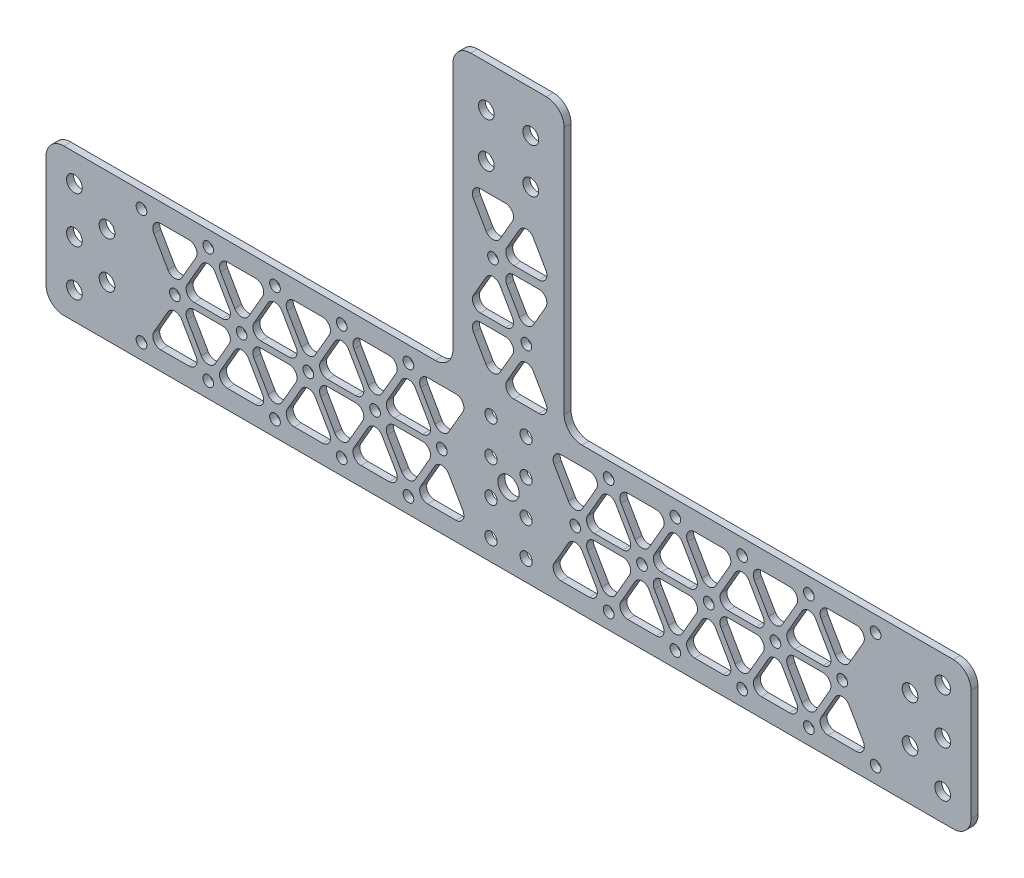
from build123d import *

# Parameters (mm, degrees)
SKETCH1_W               = 264.0778243
SKETCH1_H               = 41.91
BOSS_EXTRUDE1_DEPTH     = 1.9812
SKETCH2_R               = 2.2479
CUT_EXTRUDE1_DEPTH      = 2.54
SKETCH3_R               = 3.05
SKETCH3_R_2             = 1.75
CUT_EXTRUDE2_DEPTH      = 2.54
SKETCH4_W               = 31.75
SKETCH4_H               = 81.056319486
BOSS_EXTRUDE2_DEPTH     = 1.9812
CUT_EXTRUDE3_REACH      = 168.867
SKETCH5_R               = 2.2479
FLAT_ISOGRID1_OUTLINE_R = 1.524
FLAT_ISOGRID1_DEPTH     = 1.9812
FLAT_ISOGRID2_OUTLINE_R = 1.524
FLAT_ISOGRID2_DEPTH     = 1.9812
SKETCH9_R               = 1.524
BOSS_EXTRUDE3_DEPTH     = 1.9812
FILLET1_R               = 5.08


# Read off the part's stored shape, not the designer's step: Flat-Isogrid1, Flat-Isogrid2
with BuildPart() as part:
    # Sketch1 → Boss-Extrude1 (new body)
    with BuildSketch(Plane.XY):
        Rectangle(SKETCH1_W, SKETCH1_H)
    extrude(amount=BOSS_EXTRUDE1_DEPTH)

    # Sketch2 → Cut-Extrude1 (cut)
    with BuildSketch(Plane(origin=(0, 0, 0), x_dir=(-1, 0, 0), z_dir=(0, 0, -1))):
        with Locations((123.929430386, 13.127417544)):
            Circle(SKETCH2_R)
        with Locations((123.929430386, 0)):
            Circle(SKETCH2_R)
        with Locations((123.929430386, -13.127417544)):
            Circle(SKETCH2_R)
        with Locations((114.624809998, 6.563708772)):
            Circle(SKETCH2_R)
        with Locations((114.624809998, -6.563708772)):
            Circle(SKETCH2_R)
    cut_extrude1 = extrude(amount=-CUT_EXTRUDE1_DEPTH, mode=Mode.SUBTRACT)

    # Sketch3 → Cut-Extrude2 (cut)
    with BuildSketch(Plane(origin=(0, 0, 0), x_dir=(-1, 0, 0), z_dir=(0, 0, -1))):
        Circle(SKETCH3_R)
        with Locations((-5.020458146, 15.061374439)):
            Circle(SKETCH3_R_2)
        with Locations((5.020458146, -15.061374439)):
            Circle(SKETCH3_R_2)
        with Locations((-5.020458146, -5.020458146)):
            Circle(SKETCH3_R_2)
        with Locations((5.020458146, 5.020458146)):
            Circle(SKETCH3_R_2)
        with Locations((5.020458146, -5.020458146)):
            Circle(SKETCH3_R_2)
        with Locations((-5.020458146, 5.020458146)):
            Circle(SKETCH3_R_2)
        with Locations((-5.020458146, -15.061374439)):
            Circle(SKETCH3_R_2)
        with Locations((5.020458146, 15.061374439)):
            Circle(SKETCH3_R_2)
    extrude(amount=-CUT_EXTRUDE2_DEPTH, mode=Mode.SUBTRACT)

    # Sketch4 → Boss-Extrude2 (add)
    with BuildSketch(Plane(origin=(0, 0, 0), x_dir=(-1, 0, 0), z_dir=(0, 0, -1))):
        with Locations((0, 61.483159743)):
            Rectangle(SKETCH4_W, SKETCH4_H)
    extrude(amount=-BOSS_EXTRUDE2_DEPTH)

    # Sketch5 → Cut-Extrude3 (cut, up to next)
    with BuildSketch(Plane(origin=(0, 0, 0), x_dir=(-1, 0, 0), z_dir=(0, 0, -1)), mode=Mode.PRIVATE) as cut_extrude3_sk1:
        with Locations((-6.35, 90.168884441)):
            Circle(SKETCH5_R)
    cut_extrude3_tool1 = extrude(cut_extrude3_sk1.sketch, amount=-CUT_EXTRUDE3_REACH, mode=Mode.PRIVATE) & part.part
    # Sketch5 → Cut-Extrude3 (cut, up to next)
    with BuildSketch(Plane(origin=(0, 0, 0), x_dir=(-1, 0, 0), z_dir=(0, 0, -1)), mode=Mode.PRIVATE) as cut_extrude3_sk2:
        with Locations((6.35, 90.168884441)):
            Circle(SKETCH5_R)
    cut_extrude3_tool2 = extrude(cut_extrude3_sk2.sketch, amount=-CUT_EXTRUDE3_REACH, mode=Mode.PRIVATE) & part.part
    # Sketch5 → Cut-Extrude3 (cut, up to next)
    with BuildSketch(Plane(origin=(0, 0, 0), x_dir=(-1, 0, 0), z_dir=(0, 0, -1)), mode=Mode.PRIVATE) as cut_extrude3_sk3:
        with Locations((-6.35, 77.468884441)):
            Circle(SKETCH5_R)
    cut_extrude3_tool3 = extrude(cut_extrude3_sk3.sketch, amount=-CUT_EXTRUDE3_REACH, mode=Mode.PRIVATE) & part.part
    # Sketch5 → Cut-Extrude3 (cut, up to next)
    with BuildSketch(Plane(origin=(0, 0, 0), x_dir=(-1, 0, 0), z_dir=(0, 0, -1)), mode=Mode.PRIVATE) as cut_extrude3_sk4:
        with Locations((6.35, 77.468884441)):
            Circle(SKETCH5_R)
    cut_extrude3_tool4 = extrude(cut_extrude3_sk4.sketch, amount=-CUT_EXTRUDE3_REACH, mode=Mode.PRIVATE) & part.part
    add(cut_extrude3_tool1.solids().sort_by_distance((6.35, 90.168884, 0))[0], mode=Mode.SUBTRACT)
    add(cut_extrude3_tool2.solids().sort_by_distance((-6.35, 90.168884, 0))[0], mode=Mode.SUBTRACT)
    add(cut_extrude3_tool3.solids().sort_by_distance((6.35, 77.468884, 0))[0], mode=Mode.SUBTRACT)
    add(cut_extrude3_tool4.solids().sort_by_distance((-6.35, 77.468884, 0))[0], mode=Mode.SUBTRACT)

    # Mirror1: Cut-Extrude1 across plane
    add(cut_extrude1.mirror(Plane(origin=(0, 0, 0), x_dir=(0, 0, 1), z_dir=(1, 0, 0))), mode=Mode.SUBTRACT)

    # Flat-Isogrid1 outline → Flat-Isogrid1 (cut)
    with BuildSketch(Plane.XY):
        with Locations((-19.05, 0)):
            Circle(FLAT_ISOGRID1_OUTLINE_R)
        with Locations((19.05, 0)):
            Circle(FLAT_ISOGRID1_OUTLINE_R)
        with Locations((-38.1, 0)):
            Circle(FLAT_ISOGRID1_OUTLINE_R)
        with Locations((-28.575, 16.497783942)):
            Circle(FLAT_ISOGRID1_OUTLINE_R)
        with Locations((-28.575, -16.497783942)):
            Circle(FLAT_ISOGRID1_OUTLINE_R)
        with Locations((28.575, 16.497783942)):
            Circle(FLAT_ISOGRID1_OUTLINE_R)
        with Locations((38.1, 0)):
            Circle(FLAT_ISOGRID1_OUTLINE_R)
        with Locations((28.575, -16.497783942)):
            Circle(FLAT_ISOGRID1_OUTLINE_R)
        with Locations((-57.15, 0)):
            Circle(FLAT_ISOGRID1_OUTLINE_R)
        with Locations((-47.625, 16.497783942)):
            Circle(FLAT_ISOGRID1_OUTLINE_R)
        with Locations((-47.625, -16.497783942)):
            Circle(FLAT_ISOGRID1_OUTLINE_R)
        with Locations((47.625, 16.497783942)):
            Circle(FLAT_ISOGRID1_OUTLINE_R)
        with Locations((57.15, 0)):
            Circle(FLAT_ISOGRID1_OUTLINE_R)
        with Locations((47.625, -16.497783942)):
            Circle(FLAT_ISOGRID1_OUTLINE_R)
        with Locations((-76.2, 0)):
            Circle(FLAT_ISOGRID1_OUTLINE_R)
        with Locations((-66.675, 16.497783942)):
            Circle(FLAT_ISOGRID1_OUTLINE_R)
        with Locations((-66.675, -16.497783942)):
            Circle(FLAT_ISOGRID1_OUTLINE_R)
        with Locations((66.675, 16.497783942)):
            Circle(FLAT_ISOGRID1_OUTLINE_R)
        with Locations((76.2, 0)):
            Circle(FLAT_ISOGRID1_OUTLINE_R)
        with Locations((66.675, -16.497783942)):
            Circle(FLAT_ISOGRID1_OUTLINE_R)
        with Locations((-95.25, 0)):
            Circle(FLAT_ISOGRID1_OUTLINE_R)
        with Locations((-85.725, 16.497783942)):
            Circle(FLAT_ISOGRID1_OUTLINE_R)
        with Locations((-85.725, -16.497783942)):
            Circle(FLAT_ISOGRID1_OUTLINE_R)
        with Locations((85.725, 16.497783942)):
            Circle(FLAT_ISOGRID1_OUTLINE_R)
        with Locations((95.25, 0)):
            Circle(FLAT_ISOGRID1_OUTLINE_R)
        with Locations((85.725, -16.497783942)):
            Circle(FLAT_ISOGRID1_OUTLINE_R)
        with Locations((-104.775, 16.497783942)):
            Circle(FLAT_ISOGRID1_OUTLINE_R)
        with Locations((-104.775, -16.497783942)):
            Circle(FLAT_ISOGRID1_OUTLINE_R)
        with Locations((104.775, 16.497783942)):
            Circle(FLAT_ISOGRID1_OUTLINE_R)
        with Locations((104.775, -16.497783942)):
            Circle(FLAT_ISOGRID1_OUTLINE_R)
        with BuildLine():
            ThreePointArc((-34.580472759, 4.318), (-34.580472759, 2.032), (-32.600738686, 0.889))
            Line((-32.600738686, 0.889), (-24.549261314, 0.889))
            ThreePointArc((-24.549261314, 0.889), (-22.569527241, 2.032), (-22.569527241, 4.318))
            Line((-22.569527241, 4.318), (-26.595265927, 11.290783942))
            ThreePointArc((-26.595265927, 11.290783942), (-28.575, 12.433783942), (-30.554734073, 11.290783942))
            Line((-30.554734073, 11.290783942), (-34.580472759, 4.318))
        make_face()
        with BuildLine():
            ThreePointArc((22.569527241, 4.318), (22.569527241, 2.032), (24.549261314, 0.889))
            Line((24.549261314, 0.889), (32.600738686, 0.889))
            ThreePointArc((32.600738686, 0.889), (34.580472759, 2.032), (34.580472759, 4.318))
            Line((34.580472759, 4.318), (30.554734073, 11.290783942))
            ThreePointArc((30.554734073, 11.290783942), (28.575, 12.433783942), (26.595265927, 11.290783942))
            Line((26.595265927, 11.290783942), (22.569527241, 4.318))
        make_face()
        with BuildLine():
            ThreePointArc((-53.630472759, 4.318), (-53.630472759, 2.032), (-51.650738686, 0.889))
            Line((-51.650738686, 0.889), (-43.599261314, 0.889))
            ThreePointArc((-43.599261314, 0.889), (-41.619527241, 2.032), (-41.619527241, 4.318))
            Line((-41.619527241, 4.318), (-45.645265927, 11.290783942))
            ThreePointArc((-45.645265927, 11.290783942), (-47.625, 12.433783942), (-49.604734073, 11.290783942))
            Line((-49.604734073, 11.290783942), (-53.630472759, 4.318))
        make_face()
        with BuildLine():
            ThreePointArc((41.619527241, 4.318), (41.619527241, 2.032), (43.599261314, 0.889))
            Line((43.599261314, 0.889), (51.650738686, 0.889))
            ThreePointArc((51.650738686, 0.889), (53.630472759, 2.032), (53.630472759, 4.318))
            Line((53.630472759, 4.318), (49.604734073, 11.290783942))
            ThreePointArc((49.604734073, 11.290783942), (47.625, 12.433783942), (45.645265927, 11.290783942))
            Line((45.645265927, 11.290783942), (41.619527241, 4.318))
        make_face()
        with BuildLine():
            ThreePointArc((-72.680472759, 4.318), (-72.680472759, 2.032), (-70.700738686, 0.889))
            Line((-70.700738686, 0.889), (-62.649261314, 0.889))
            ThreePointArc((-62.649261314, 0.889), (-60.669527241, 2.032), (-60.669527241, 4.318))
            Line((-60.669527241, 4.318), (-64.695265927, 11.290783942))
            ThreePointArc((-64.695265927, 11.290783942), (-66.675, 12.433783942), (-68.654734073, 11.290783942))
            Line((-68.654734073, 11.290783942), (-72.680472759, 4.318))
        make_face()
        with BuildLine():
            ThreePointArc((60.669527241, 4.318), (60.669527241, 2.032), (62.649261314, 0.889))
            Line((62.649261314, 0.889), (70.700738686, 0.889))
            ThreePointArc((70.700738686, 0.889), (72.680472759, 2.032), (72.680472759, 4.318))
            Line((72.680472759, 4.318), (68.654734073, 11.290783942))
            ThreePointArc((68.654734073, 11.290783942), (66.675, 12.433783942), (64.695265927, 11.290783942))
            Line((64.695265927, 11.290783942), (60.669527241, 4.318))
        make_face()
        with BuildLine():
            ThreePointArc((-91.730472759, 4.318), (-91.730472759, 2.032), (-89.750738686, 0.889))
            Line((-89.750738686, 0.889), (-81.699261314, 0.889))
            ThreePointArc((-81.699261314, 0.889), (-79.719527241, 2.032), (-79.719527241, 4.318))
            Line((-79.719527241, 4.318), (-83.745265927, 11.290783942))
            ThreePointArc((-83.745265927, 11.290783942), (-85.725, 12.433783942), (-87.704734073, 11.290783942))
            Line((-87.704734073, 11.290783942), (-91.730472759, 4.318))
        make_face()
        with BuildLine():
            ThreePointArc((79.719527241, 4.318), (79.719527241, 2.032), (81.699261314, 0.889))
            Line((81.699261314, 0.889), (89.750738686, 0.889))
            ThreePointArc((89.750738686, 0.889), (91.730472759, 2.032), (91.730472759, 4.318))
            Line((91.730472759, 4.318), (87.704734073, 11.290783942))
            ThreePointArc((87.704734073, 11.290783942), (85.725, 12.433783942), (83.745265927, 11.290783942))
            Line((83.745265927, 11.290783942), (79.719527241, 4.318))
        make_face()
        with BuildLine():
            ThreePointArc((-15.024261314, -15.608783942), (-13.044527241, -14.465783942), (-13.044527241, -12.179783942))
            Line((-13.044527241, -12.179783942), (-17.070265927, -5.207))
            ThreePointArc((-17.070265927, -5.207), (-19.05, -4.064), (-21.029734073, -5.207))
            Line((-21.029734073, -5.207), (-25.055472759, -12.179783942))
            ThreePointArc((-25.055472759, -12.179783942), (-25.055472759, -14.465783942), (-23.075738686, -15.608783942))
            Line((-23.075738686, -15.608783942), (-15.024261314, -15.608783942))
        make_face()
        with BuildLine():
            ThreePointArc((-36.120265927, -5.207), (-38.1, -4.064), (-40.079734073, -5.207))
            Line((-40.079734073, -5.207), (-44.105472759, -12.179783942))
            ThreePointArc((-44.105472759, -12.179783942), (-44.105472759, -14.465783942), (-42.125738686, -15.608783942))
            Line((-42.125738686, -15.608783942), (-34.074261314, -15.608783942))
            ThreePointArc((-34.074261314, -15.608783942), (-32.094527241, -14.465783942), (-32.094527241, -12.179783942))
            Line((-32.094527241, -12.179783942), (-36.120265927, -5.207))
        make_face()
        with BuildLine():
            ThreePointArc((-13.044527241, 12.179783942), (-13.044527241, 14.465783942), (-15.024261314, 15.608783942))
            Line((-15.024261314, 15.608783942), (-23.075738686, 15.608783942))
            ThreePointArc((-23.075738686, 15.608783942), (-25.055472759, 14.465783942), (-25.055472759, 12.179783942))
            Line((-25.055472759, 12.179783942), (-21.029734073, 5.207))
            ThreePointArc((-21.029734073, 5.207), (-19.05, 4.064), (-17.070265927, 5.207))
            Line((-17.070265927, 5.207), (-13.044527241, 12.179783942))
        make_face()
        with BuildLine():
            ThreePointArc((25.055472759, 12.179783942), (25.055472759, 14.465783942), (23.075738686, 15.608783942))
            Line((23.075738686, 15.608783942), (15.024261314, 15.608783942))
            ThreePointArc((15.024261314, 15.608783942), (13.044527241, 14.465783942), (13.044527241, 12.179783942))
            Line((13.044527241, 12.179783942), (17.070265927, 5.207))
            ThreePointArc((17.070265927, 5.207), (19.05, 4.064), (21.029734073, 5.207))
            Line((21.029734073, 5.207), (25.055472759, 12.179783942))
        make_face()
        with BuildLine():
            ThreePointArc((-32.094527241, 12.179783942), (-32.094527241, 14.465783942), (-34.074261314, 15.608783942))
            Line((-34.074261314, 15.608783942), (-42.125738686, 15.608783942))
            ThreePointArc((-42.125738686, 15.608783942), (-44.105472759, 14.465783942), (-44.105472759, 12.179783942))
            Line((-44.105472759, 12.179783942), (-40.079734073, 5.207))
            ThreePointArc((-40.079734073, 5.207), (-38.1, 4.064), (-36.120265927, 5.207))
            Line((-36.120265927, 5.207), (-32.094527241, 12.179783942))
        make_face()
        with BuildLine():
            ThreePointArc((44.105472759, 12.179783942), (44.105472759, 14.465783942), (42.125738686, 15.608783942))
            Line((42.125738686, 15.608783942), (34.074261314, 15.608783942))
            ThreePointArc((34.074261314, 15.608783942), (32.094527241, 14.465783942), (32.094527241, 12.179783942))
            Line((32.094527241, 12.179783942), (36.120265927, 5.207))
            ThreePointArc((36.120265927, 5.207), (38.1, 4.064), (40.079734073, 5.207))
            Line((40.079734073, 5.207), (44.105472759, 12.179783942))
        make_face()
        with BuildLine():
            ThreePointArc((-51.144527241, 12.179783942), (-51.144527241, 14.465783942), (-53.124261314, 15.608783942))
            Line((-53.124261314, 15.608783942), (-61.175738686, 15.608783942))
            ThreePointArc((-61.175738686, 15.608783942), (-63.155472759, 14.465783942), (-63.155472759, 12.179783942))
            Line((-63.155472759, 12.179783942), (-59.129734073, 5.207))
            ThreePointArc((-59.129734073, 5.207), (-57.15, 4.064), (-55.170265927, 5.207))
            Line((-55.170265927, 5.207), (-51.144527241, 12.179783942))
        make_face()
        with BuildLine():
            ThreePointArc((63.155472759, 12.179783942), (63.155472759, 14.465783942), (61.175738686, 15.608783942))
            Line((61.175738686, 15.608783942), (53.124261314, 15.608783942))
            ThreePointArc((53.124261314, 15.608783942), (51.144527241, 14.465783942), (51.144527241, 12.179783942))
            Line((51.144527241, 12.179783942), (55.170265927, 5.207))
            ThreePointArc((55.170265927, 5.207), (57.15, 4.064), (59.129734073, 5.207))
            Line((59.129734073, 5.207), (63.155472759, 12.179783942))
        make_face()
        with BuildLine():
            ThreePointArc((-70.194527241, 12.179783942), (-70.194527241, 14.465783942), (-72.174261314, 15.608783942))
            Line((-72.174261314, 15.608783942), (-80.225738686, 15.608783942))
            ThreePointArc((-80.225738686, 15.608783942), (-82.205472759, 14.465783942), (-82.205472759, 12.179783942))
            Line((-82.205472759, 12.179783942), (-78.179734073, 5.207))
            ThreePointArc((-78.179734073, 5.207), (-76.2, 4.064), (-74.220265927, 5.207))
            Line((-74.220265927, 5.207), (-70.194527241, 12.179783942))
        make_face()
        with BuildLine():
            ThreePointArc((82.205472759, 12.179783942), (82.205472759, 14.465783942), (80.225738686, 15.608783942))
            Line((80.225738686, 15.608783942), (72.174261314, 15.608783942))
            ThreePointArc((72.174261314, 15.608783942), (70.194527241, 14.465783942), (70.194527241, 12.179783942))
            Line((70.194527241, 12.179783942), (74.220265927, 5.207))
            ThreePointArc((74.220265927, 5.207), (76.2, 4.064), (78.179734073, 5.207))
            Line((78.179734073, 5.207), (82.205472759, 12.179783942))
        make_face()
        with BuildLine():
            ThreePointArc((-89.244527241, 12.179783942), (-89.244527241, 14.465783942), (-91.224261314, 15.608783942))
            Line((-91.224261314, 15.608783942), (-99.275738686, 15.608783942))
            ThreePointArc((-99.275738686, 15.608783942), (-101.255472759, 14.465783942), (-101.255472759, 12.179783942))
            Line((-101.255472759, 12.179783942), (-97.229734073, 5.207))
            ThreePointArc((-97.229734073, 5.207), (-95.25, 4.064), (-93.270265927, 5.207))
            Line((-93.270265927, 5.207), (-89.244527241, 12.179783942))
        make_face()
        with BuildLine():
            ThreePointArc((101.255472759, 12.179783942), (101.255472759, 14.465783942), (99.275738686, 15.608783942))
            Line((99.275738686, 15.608783942), (91.224261314, 15.608783942))
            ThreePointArc((91.224261314, 15.608783942), (89.244527241, 14.465783942), (89.244527241, 12.179783942))
            Line((89.244527241, 12.179783942), (93.270265927, 5.207))
            ThreePointArc((93.270265927, 5.207), (95.25, 4.064), (97.229734073, 5.207))
            Line((97.229734073, 5.207), (101.255472759, 12.179783942))
        make_face()
        with BuildLine():
            ThreePointArc((-30.554734073, -11.290783942), (-28.575, -12.433783942), (-26.595265927, -11.290783942))
            Line((-26.595265927, -11.290783942), (-22.569527241, -4.318))
            ThreePointArc((-22.569527241, -4.318), (-22.569527241, -2.032), (-24.549261314, -0.889))
            Line((-24.549261314, -0.889), (-32.600738686, -0.889))
            ThreePointArc((-32.600738686, -0.889), (-34.580472759, -2.032), (-34.580472759, -4.318))
            Line((-34.580472759, -4.318), (-30.554734073, -11.290783942))
        make_face()
        with BuildLine():
            ThreePointArc((13.044527241, -12.179783942), (13.044527241, -14.465783942), (15.024261314, -15.608783942))
            Line((15.024261314, -15.608783942), (23.075738686, -15.608783942))
            ThreePointArc((23.075738686, -15.608783942), (25.055472759, -14.465783942), (25.055472759, -12.179783942))
            Line((25.055472759, -12.179783942), (21.029734073, -5.207))
            ThreePointArc((21.029734073, -5.207), (19.05, -4.064), (17.070265927, -5.207))
            Line((17.070265927, -5.207), (13.044527241, -12.179783942))
        make_face()
        with BuildLine():
            ThreePointArc((32.094527241, -12.179783942), (32.094527241, -14.465783942), (34.074261314, -15.608783942))
            Line((34.074261314, -15.608783942), (42.125738686, -15.608783942))
            ThreePointArc((42.125738686, -15.608783942), (44.105472759, -14.465783942), (44.105472759, -12.179783942))
            Line((44.105472759, -12.179783942), (40.079734073, -5.207))
            ThreePointArc((40.079734073, -5.207), (38.1, -4.064), (36.120265927, -5.207))
            Line((36.120265927, -5.207), (32.094527241, -12.179783942))
        make_face()
        with BuildLine():
            ThreePointArc((-63.155472759, -12.179783942), (-63.155472759, -14.465783942), (-61.175738686, -15.608783942))
            Line((-61.175738686, -15.608783942), (-53.124261314, -15.608783942))
            ThreePointArc((-53.124261314, -15.608783942), (-51.144527241, -14.465783942), (-51.144527241, -12.179783942))
            Line((-51.144527241, -12.179783942), (-55.170265927, -5.207))
            ThreePointArc((-55.170265927, -5.207), (-57.15, -4.064), (-59.129734073, -5.207))
            Line((-59.129734073, -5.207), (-63.155472759, -12.179783942))
        make_face()
        with BuildLine():
            ThreePointArc((51.144527241, -12.179783942), (51.144527241, -14.465783942), (53.124261314, -15.608783942))
            Line((53.124261314, -15.608783942), (61.175738686, -15.608783942))
            ThreePointArc((61.175738686, -15.608783942), (63.155472759, -14.465783942), (63.155472759, -12.179783942))
            Line((63.155472759, -12.179783942), (59.129734073, -5.207))
            ThreePointArc((59.129734073, -5.207), (57.15, -4.064), (55.170265927, -5.207))
            Line((55.170265927, -5.207), (51.144527241, -12.179783942))
        make_face()
        with BuildLine():
            ThreePointArc((-82.205472759, -12.179783942), (-82.205472759, -14.465783942), (-80.225738686, -15.608783942))
            Line((-80.225738686, -15.608783942), (-72.174261314, -15.608783942))
            ThreePointArc((-72.174261314, -15.608783942), (-70.194527241, -14.465783942), (-70.194527241, -12.179783942))
            Line((-70.194527241, -12.179783942), (-74.220265927, -5.207))
            ThreePointArc((-74.220265927, -5.207), (-76.2, -4.064), (-78.179734073, -5.207))
            Line((-78.179734073, -5.207), (-82.205472759, -12.179783942))
        make_face()
        with BuildLine():
            ThreePointArc((70.194527241, -12.179783942), (70.194527241, -14.465783942), (72.174261314, -15.608783942))
            Line((72.174261314, -15.608783942), (80.225738686, -15.608783942))
            ThreePointArc((80.225738686, -15.608783942), (82.205472759, -14.465783942), (82.205472759, -12.179783942))
            Line((82.205472759, -12.179783942), (78.179734073, -5.207))
            ThreePointArc((78.179734073, -5.207), (76.2, -4.064), (74.220265927, -5.207))
            Line((74.220265927, -5.207), (70.194527241, -12.179783942))
        make_face()
        with BuildLine():
            ThreePointArc((-101.255472759, -12.179783942), (-101.255472759, -14.465783942), (-99.275738686, -15.608783942))
            Line((-99.275738686, -15.608783942), (-91.224261314, -15.608783942))
            ThreePointArc((-91.224261314, -15.608783942), (-89.244527241, -14.465783942), (-89.244527241, -12.179783942))
            Line((-89.244527241, -12.179783942), (-93.270265927, -5.207))
            ThreePointArc((-93.270265927, -5.207), (-95.25, -4.064), (-97.229734073, -5.207))
            Line((-97.229734073, -5.207), (-101.255472759, -12.179783942))
        make_face()
        with BuildLine():
            ThreePointArc((89.244527241, -12.179783942), (89.244527241, -14.465783942), (91.224261314, -15.608783942))
            Line((91.224261314, -15.608783942), (99.275738686, -15.608783942))
            ThreePointArc((99.275738686, -15.608783942), (101.255472759, -14.465783942), (101.255472759, -12.179783942))
            Line((101.255472759, -12.179783942), (97.229734073, -5.207))
            ThreePointArc((97.229734073, -5.207), (95.25, -4.064), (93.270265927, -5.207))
            Line((93.270265927, -5.207), (89.244527241, -12.179783942))
        make_face()
        with BuildLine():
            ThreePointArc((34.580472759, -4.318), (34.580472759, -2.032), (32.600738686, -0.889))
            Line((32.600738686, -0.889), (24.549261314, -0.889))
            ThreePointArc((24.549261314, -0.889), (22.569527241, -2.032), (22.569527241, -4.318))
            Line((22.569527241, -4.318), (26.595265927, -11.290783942))
            ThreePointArc((26.595265927, -11.290783942), (28.575, -12.433783942), (30.554734073, -11.290783942))
            Line((30.554734073, -11.290783942), (34.580472759, -4.318))
        make_face()
        with BuildLine():
            ThreePointArc((-41.619527241, -4.318), (-41.619527241, -2.032), (-43.599261314, -0.889))
            Line((-43.599261314, -0.889), (-51.650738686, -0.889))
            ThreePointArc((-51.650738686, -0.889), (-53.630472759, -2.032), (-53.630472759, -4.318))
            Line((-53.630472759, -4.318), (-49.604734073, -11.290783942))
            ThreePointArc((-49.604734073, -11.290783942), (-47.625, -12.433783942), (-45.645265927, -11.290783942))
            Line((-45.645265927, -11.290783942), (-41.619527241, -4.318))
        make_face()
        with BuildLine():
            ThreePointArc((53.630472759, -4.318), (53.630472759, -2.032), (51.650738686, -0.889))
            Line((51.650738686, -0.889), (43.599261314, -0.889))
            ThreePointArc((43.599261314, -0.889), (41.619527241, -2.032), (41.619527241, -4.318))
            Line((41.619527241, -4.318), (45.645265927, -11.290783942))
            ThreePointArc((45.645265927, -11.290783942), (47.625, -12.433783942), (49.604734073, -11.290783942))
            Line((49.604734073, -11.290783942), (53.630472759, -4.318))
        make_face()
        with BuildLine():
            ThreePointArc((-60.669527241, -4.318), (-60.669527241, -2.032), (-62.649261314, -0.889))
            Line((-62.649261314, -0.889), (-70.700738686, -0.889))
            ThreePointArc((-70.700738686, -0.889), (-72.680472759, -2.032), (-72.680472759, -4.318))
            Line((-72.680472759, -4.318), (-68.654734073, -11.290783942))
            ThreePointArc((-68.654734073, -11.290783942), (-66.675, -12.433783942), (-64.695265927, -11.290783942))
            Line((-64.695265927, -11.290783942), (-60.669527241, -4.318))
        make_face()
        with BuildLine():
            ThreePointArc((72.680472759, -4.318), (72.680472759, -2.032), (70.700738686, -0.889))
            Line((70.700738686, -0.889), (62.649261314, -0.889))
            ThreePointArc((62.649261314, -0.889), (60.669527241, -2.032), (60.669527241, -4.318))
            Line((60.669527241, -4.318), (64.695265927, -11.290783942))
            ThreePointArc((64.695265927, -11.290783942), (66.675, -12.433783942), (68.654734073, -11.290783942))
            Line((68.654734073, -11.290783942), (72.680472759, -4.318))
        make_face()
        with BuildLine():
            ThreePointArc((-79.719527241, -4.318), (-79.719527241, -2.032), (-81.699261314, -0.889))
            Line((-81.699261314, -0.889), (-89.750738686, -0.889))
            ThreePointArc((-89.750738686, -0.889), (-91.730472759, -2.032), (-91.730472759, -4.318))
            Line((-91.730472759, -4.318), (-87.704734073, -11.290783942))
            ThreePointArc((-87.704734073, -11.290783942), (-85.725, -12.433783942), (-83.745265927, -11.290783942))
            Line((-83.745265927, -11.290783942), (-79.719527241, -4.318))
        make_face()
        with BuildLine():
            ThreePointArc((91.730472759, -4.318), (91.730472759, -2.032), (89.750738686, -0.889))
            Line((89.750738686, -0.889), (81.699261314, -0.889))
            ThreePointArc((81.699261314, -0.889), (79.719527241, -2.032), (79.719527241, -4.318))
            Line((79.719527241, -4.318), (83.745265927, -11.290783942))
            ThreePointArc((83.745265927, -11.290783942), (85.725, -12.433783942), (87.704734073, -11.290783942))
            Line((87.704734073, -11.290783942), (91.730472759, -4.318))
        make_face()
    extrude(amount=FLAT_ISOGRID1_DEPTH, mode=Mode.SUBTRACT)

    # Flat-Isogrid2 outline → Flat-Isogrid2 (cut)
    with BuildSketch(Plane.XY):
        with Locations((5.08, 37.988159743)):
            Circle(FLAT_ISOGRID2_OUTLINE_R)
        with Locations((-4.445, 54.485943685)):
            Circle(FLAT_ISOGRID2_OUTLINE_R)
        with Locations((5.08, 70.983727627)):
            Circle(FLAT_ISOGRID2_OUTLINE_R)
        with BuildLine():
            ThreePointArc((-10.010531854, 42.560159743), (-10.010531854, 40.274159743), (-8.030797781, 39.131159743))
            Line((-8.030797781, 39.131159743), (-0.859202219, 39.131159743))
            ThreePointArc((-0.859202219, 39.131159743), (1.120531854, 40.274159743), (1.120531854, 42.560159743))
            Line((1.120531854, 42.560159743), (-2.465265927, 48.770943685))
            ThreePointArc((-2.465265927, 48.770943685), (-4.445, 49.913943685), (-6.424734073, 48.770943685))
            Line((-6.424734073, 48.770943685), (-10.010531854, 42.560159743))
        make_face()
        with BuildLine():
            ThreePointArc((8.665797781, 22.633375801), (10.645531854, 23.776375801), (10.645531854, 26.062375801))
            Line((10.645531854, 26.062375801), (7.059734073, 32.273159743))
            ThreePointArc((7.059734073, 32.273159743), (5.08, 33.416159743), (3.100265927, 32.273159743))
            Line((3.100265927, 32.273159743), (-0.485531854, 26.062375801))
            ThreePointArc((-0.485531854, 26.062375801), (-0.485531854, 23.776375801), (1.494202219, 22.633375801))
            Line((1.494202219, 22.633375801), (8.665797781, 22.633375801))
        make_face()
        with BuildLine():
            ThreePointArc((7.059734073, 65.268727627), (5.08, 66.411727627), (3.100265927, 65.268727627))
            Line((3.100265927, 65.268727627), (-0.485531854, 59.057943685))
            ThreePointArc((-0.485531854, 59.057943685), (-0.485531854, 56.771943685), (1.494202219, 55.628943685))
            Line((1.494202219, 55.628943685), (8.665797781, 55.628943685))
            ThreePointArc((8.665797781, 55.628943685), (10.645531854, 56.771943685), (10.645531854, 59.057943685))
            Line((10.645531854, 59.057943685), (7.059734073, 65.268727627))
        make_face()
        with BuildLine():
            ThreePointArc((10.645531854, 49.913943685), (10.645531854, 52.199943685), (8.665797781, 53.342943685))
            Line((8.665797781, 53.342943685), (1.494202219, 53.342943685))
            ThreePointArc((1.494202219, 53.342943685), (-0.485531854, 52.199943685), (-0.485531854, 49.913943685))
            Line((-0.485531854, 49.913943685), (3.100265927, 43.703159743))
            ThreePointArc((3.100265927, 43.703159743), (5.08, 42.560159743), (7.059734073, 43.703159743))
            Line((7.059734073, 43.703159743), (10.645531854, 49.913943685))
        make_face()
        with BuildLine():
            ThreePointArc((-8.030797781, 69.840727627), (-10.010531854, 68.697727627), (-10.010531854, 66.411727627))
            Line((-10.010531854, 66.411727627), (-6.424734073, 60.200943685))
            ThreePointArc((-6.424734073, 60.200943685), (-4.445, 59.057943685), (-2.465265927, 60.200943685))
            Line((-2.465265927, 60.200943685), (1.120531854, 66.411727627))
            ThreePointArc((1.120531854, 66.411727627), (1.120531854, 68.697727627), (-0.859202219, 69.840727627))
            Line((-0.859202219, 69.840727627), (-8.030797781, 69.840727627))
        make_face()
        with BuildLine():
            ThreePointArc((-6.424734073, 27.205375801), (-4.445, 26.062375801), (-2.465265927, 27.205375801))
            Line((-2.465265927, 27.205375801), (1.120531854, 33.416159743))
            ThreePointArc((1.120531854, 33.416159743), (1.120531854, 35.702159743), (-0.859202219, 36.845159743))
            Line((-0.859202219, 36.845159743), (-8.030797781, 36.845159743))
            ThreePointArc((-8.030797781, 36.845159743), (-10.010531854, 35.702159743), (-10.010531854, 33.416159743))
            Line((-10.010531854, 33.416159743), (-6.424734073, 27.205375801))
        make_face()
    extrude(amount=FLAT_ISOGRID2_DEPTH, mode=Mode.SUBTRACT)

    # Sketch9 → Boss-Extrude3 (add)
    with BuildSketch(Plane(origin=(0, 0, 0), x_dir=(-1, 0, 0), z_dir=(0, 0, -1))):
        with Locations((-5.08, 70.983727627)):
            Circle(SKETCH9_R)
    extrude(amount=-BOSS_EXTRUDE3_DEPTH)

    # Fillet1
    fillet1_edges = [part.edges().sort_by_distance(p)[0] for p in [
        (-132.03891215, 20.955, 0.9906),
        (132.03891215, 20.955, 0.9906),
        (132.03891215, -20.955, 0.9906),
        (-132.03891215, -20.955, 0.9906),
        (-15.875, 20.955, 0.9906),
        (-15.875, 102.011319486, 0.9906),
        (15.875, 102.011319486, 0.9906),
        (15.875, 20.955, 0.9906),
    ]]
    fillet(fillet1_edges, radius=FILLET1_R)


solid = part.part
